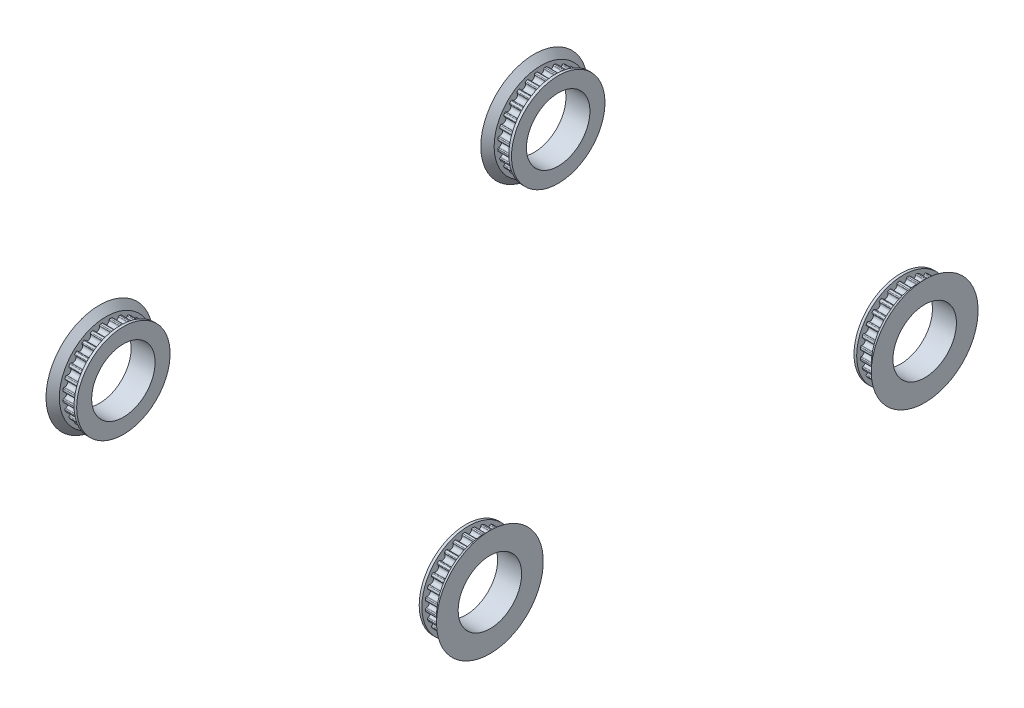
from build123d import *

# Parameters (mm, degrees)
SKETCH4_R           = 9.525
BOSS_EXTRUDE2_DEPTH = 2.2
CIRPATTERN1_COUNT   = 28
SKETCH8_W           = 0.8
SKETCH8_H           = 4.5
LPATTERN1_COUNT     = 2
LPATTERN1_PITCH     = 130.499998656


with BuildPart() as part:
    # Sketch4 → Boss-Extrude2 (new, symmetric)
    with BuildSketch(Plane(origin=(54.399999952, 0, 45.700000016), x_dir=(0, 0, -1), z_dir=(1, 0, 0))):
        with BuildLine():
            Line((44.796783018, 12.578098898), (44.779877257, 12.715785275))
            ThreePointArc((44.779877257, 12.715785275), (44.688626474, 12.879963411), (44.508813894, 12.934264441))
            ThreePointArc((44.508813894, 12.934264441), (44.377185099, 12.921465927), (44.245693436, 12.907327894))
            Line((44.245693436, 12.907327894), (44.381170452, 11.70493612))
            ThreePointArc((44.381170452, 11.70493612), (45.700000016, -11.779), (47.01882958, 11.70493612))
            Line((47.01882958, 11.70493612), (47.154306596, 12.907327894))
            ThreePointArc((47.154306596, 12.907327894), (47.022814933, 12.921465927), (46.891186138, 12.934264441))
            ThreePointArc((46.891186138, 12.934264441), (46.711373558, 12.879963411), (46.620122775, 12.715785275))
            Line((46.620122775, 12.715785275), (46.603217014, 12.578098898))
            ThreePointArc((46.603217014, 12.578098898), (45.700000016, 11.779), (44.796783018, 12.578098898))
        make_face()
        with Locations(Location((45.700000016, 0, 0), (0, 0, 180))):
            Circle(SKETCH4_R, mode=Mode.SUBTRACT)
    boss_extrude2 = extrude(amount=BOSS_EXTRUDE2_DEPTH, both=True)

    # CirPattern1: Boss-Extrude2 ×28 about axis
    cirpattern1_axis = Axis((0, 0, 0), (1, 0, 0))
    for i in range(1, CIRPATTERN1_COUNT):
        add(boss_extrude2.rotate(cirpattern1_axis, i * 360 / CIRPATTERN1_COUNT))

    # Sketch8 → Revolve1 (revolve)
    with BuildSketch(Plane(origin=(0, 0, 0), x_dir=(1, 0, 0), z_dir=(0, 1, 0)), mode=Mode.PRIVATE) as revolve1_sk:
        with Locations((51.799999952, 11.775)):
            Rectangle(SKETCH8_W, SKETCH8_H)
        Polygon((56.599999952, 14.025), (56.599999952, 9.525), (58.599999952, 9.525), (58.599999952, 16.025), align=None)
    revolve(revolve1_sk.sketch.rotate(Axis((52.199999952, 0, 0), (1, 0, 0)), 180), axis=Axis((52.199999952, 0, 0), (1, 0, 0)))


with BuildPart() as lpattern1_1:
    # LPattern1: pattern copy
    add(part.part.moved(Location(Vector(0, 0, 1) * (1 * LPATTERN1_PITCH))))


with BuildPart() as body_3:
    # Mirror1: mirrored copy
    add(lpattern1_1.part.mirror(Plane(origin=(0, 0, 0), x_dir=(0, 0, 1), z_dir=(1, 0, 0))))


with BuildPart() as body_4:
    # Mirror1 2: mirrored copy
    add(part.part.mirror(Plane(origin=(0, 0, 0), x_dir=(0, 0, 1), z_dir=(1, 0, 0))))


solid = Compound([part.part, lpattern1_1.part, body_3.part, body_4.part])
